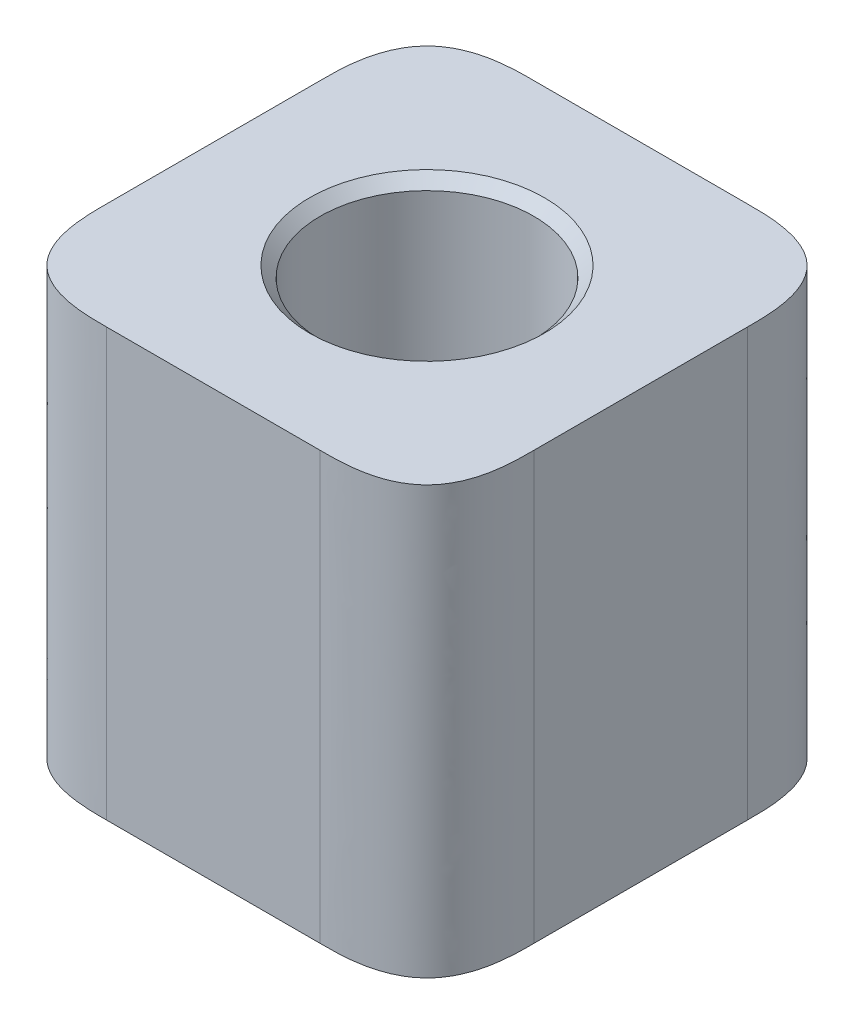
from build123d import *

# Parameters (mm, degrees)
SKETCH2_W                                       = 8
SKETCH2_H                                       = 8
SKETCH2_R                                       = 2
BOSS_EXTRUDE1_DEPTH                             = 7
SKETCH3_W                                       = 8
SKETCH3_H                                       = 8
BOSS_EXTRUDE2_DEPTH                             = 1
FILLET1_SIZE                                    = 2
CSK_FOR_M2_FLAT_HEAD_MACHINE_SCREW1_D           = 2.4
CSK_FOR_M2_FLAT_HEAD_MACHINE_SCREW1_DEPTH       = 7
CSK_FOR_M2_FLAT_HEAD_MACHINE_SCREW1_CSINK_D     = 4.4
CSK_FOR_M2_FLAT_HEAD_MACHINE_SCREW1_CSINK_ANGLE = 90


with BuildPart() as part:
    # Sketch2 → Boss-Extrude1 (new body)
    with BuildSketch(Plane(origin=(0, 0, 0), x_dir=(1, 0, 0), z_dir=(0, 1, 0))):
        Rectangle(SKETCH2_W, SKETCH2_H)
        with Locations(Location((0, 0, 0), (0, 0, 270))):
            Circle(SKETCH2_R, mode=Mode.SUBTRACT)
    extrude(amount=BOSS_EXTRUDE1_DEPTH)

    # Sketch3 → Boss-Extrude2 (add)
    with BuildSketch(Plane.XZ):
        Rectangle(SKETCH3_W, SKETCH3_H)
    extrude(amount=BOSS_EXTRUDE2_DEPTH)

    # Fillet1
    # a fillet whose section is not a circle: 2 mm, written as the material it takes off along each edge
    with BuildSketch(Plane(origin=(4, -6, 4), x_dir=(-1, 0, 0), z_dir=(0, 1, 0)), Plane(origin=(-4, 12, 4), x_dir=(1, 0, 0), z_dir=(0, -1, 0))) as fillet1_piece_1:
        with BuildLine():
            add(Edge.make_bspline([(FILLET1_SIZE, 0), (FILLET1_SIZE * 0.831801948466, 0), (FILLET1_SIZE * 0.663603896932, 0), (FILLET1_SIZE * 0.292893218813, -FILLET1_SIZE * 0.0716919198361), (FILLET1_SIZE * 0.0716919198361, -FILLET1_SIZE * 0.292893218813), (0, -FILLET1_SIZE * 0.663603896932), (0, -FILLET1_SIZE * 0.831801948466), (0, -FILLET1_SIZE)], knots=[0, 0, 0, 0, 0, 0, 0.5, 0.5, 1, 1, 1, 1, 1, 1], degree=5))
            Line((0, -FILLET1_SIZE), (0, 0))
            Line((0, 0), (FILLET1_SIZE, 0))
        make_face()
    extrude(amount=18, mode=Mode.SUBTRACT)
    with BuildSketch(Plane(origin=(-4, 12, -4), x_dir=(1, 0, 0), z_dir=(0, -1, 0)), Plane(origin=(4, -6, -4), x_dir=(-1, 0, 0), z_dir=(0, 1, 0))) as fillet1_piece_2:
        with BuildLine():
            add(Edge.make_bspline([(FILLET1_SIZE, 0), (FILLET1_SIZE * 0.831801948466, 0), (FILLET1_SIZE * 0.663603896932, 0), (FILLET1_SIZE * 0.292893218813, FILLET1_SIZE * 0.0716919198361), (FILLET1_SIZE * 0.0716919198361, FILLET1_SIZE * 0.292893218813), (0, FILLET1_SIZE * 0.663603896932), (0, FILLET1_SIZE * 0.831801948466), (0, FILLET1_SIZE)], knots=[0, 0, 0, 0, 0, 0, 0.5, 0.5, 1, 1, 1, 1, 1, 1], degree=5))
            Line((0, FILLET1_SIZE), (0, 0))
            Line((0, 0), (FILLET1_SIZE, 0))
        make_face()
    extrude(amount=18, mode=Mode.SUBTRACT)

    # CSK for M2 Flat Head Machine Screw1
    with Locations(Plane(origin=(0, 7, 0), x_dir=(1, 0, 0), z_dir=(0, 1, 0))):
        with Locations((0, 0)):
            CounterSinkHole(CSK_FOR_M2_FLAT_HEAD_MACHINE_SCREW1_D / 2, CSK_FOR_M2_FLAT_HEAD_MACHINE_SCREW1_CSINK_D / 2, depth=CSK_FOR_M2_FLAT_HEAD_MACHINE_SCREW1_DEPTH, counter_sink_angle=CSK_FOR_M2_FLAT_HEAD_MACHINE_SCREW1_CSINK_ANGLE)


solid = part.part
